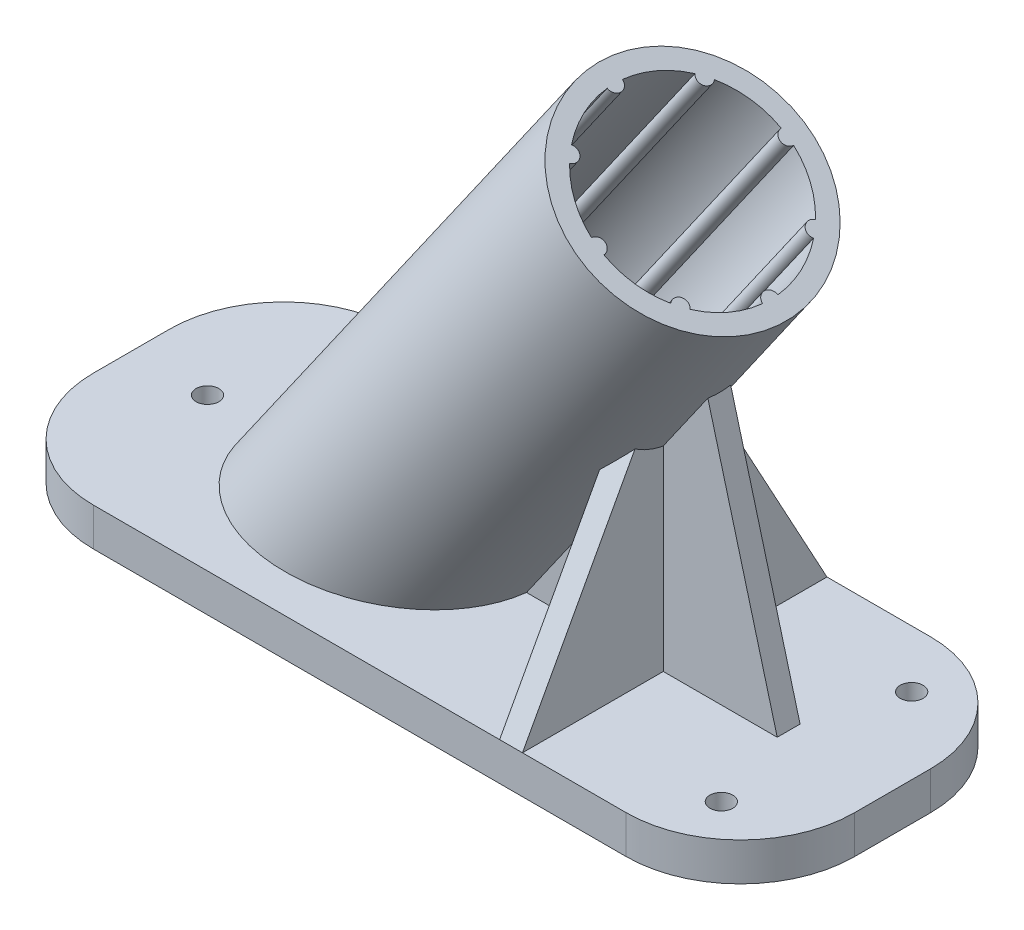
from build123d import *

# Parameters (mm, degrees)
BOSS_EXTRUDE1_DEPTH = 5
BOSS_EXTRUDE2_REACH = 104.182
SKETCH3_R           = 15
SKETCH3_R_2         = 12.5
BOSS_EXTRUDE3_REACH = 104.182
SKETCH4_R           = 1
CIRPATTERN1_START   = 1.089571064
CIRPATTERN1_DEPTH   = 61.685010975
CIRPATTERN1_START_2 = -13.151834357
CIRPATTERN1_2_DEPTH = 16.804980917
CIRPATTERN1_START_3 = -6.049458183
CIRPATTERN1_3_DEPTH = 9.702604743
RIB2_REACH          = 89.235
SKETCH5_WALL_W      = 196.470282612
SKETCH5_WALL_H      = 3
RIB3_REACH          = 101.962
SKETCH6_WALL_W      = 240.643320444
SKETCH6_WALL_H      = 3
SKETCH7_R           = 1.5
CUT_EXTRUDE1_DEPTH  = 5


with BuildPart() as part:
    # Sketch2 → Boss-Extrude1 (new body)
    with BuildSketch(Plane(origin=(0, 0, 0), x_dir=(1, 0, 0), z_dir=(0, 1, 0))):
        with BuildLine():
            Line((35, 20), (-35, 20))
            ThreePointArc((-35, 20), (-45.606601718, 15.606601718), (-50, 5))
            Line((-50, 5), (-50, -5))
            ThreePointArc((-50, -5), (-45.606601718, -15.606601718), (-35, -20))
            Line((-35, -20), (35, -20))
            ThreePointArc((35, -20), (45.606601718, -15.606601718), (50, -5))
            Line((50, -5), (50, 5))
            ThreePointArc((50, 5), (45.606601718, 15.606601718), (35, 20))
        make_face()
    extrude(amount=BOSS_EXTRUDE1_DEPTH)

    # Boss-Extrude2: up to this plane
    boss_extrude2_end = Plane(origin=(35, 5, 5), z_dir=(0, -1, 0))
    # Sketch3 → Boss-Extrude2 (add, up to the surface)
    with BuildSketch(Plane(origin=(36.006021059, 51.421927207, 0), x_dir=(0, 0, -1), z_dir=(0.5735764363510473, 0.819152044288991, 0)), mode=Mode.PRIVATE) as boss_extrude2_sk1:
        with Locations(Location((0, 15, 0), (0, 0, 90))):
            Circle(SKETCH3_R)
        with Locations(Location((0, 15, 0), (0, 0, 90))):
            Circle(SKETCH3_R_2, mode=Mode.SUBTRACT)
    boss_extrude2_tool1 = split(extrude(boss_extrude2_sk1.sketch, amount=-BOSS_EXTRUDE2_REACH, mode=Mode.PRIVATE), bisect_by=boss_extrude2_end, keep=Keep.BOTH, mode=Mode.PRIVATE)
    add(boss_extrude2_tool1.solids().sort_by_distance((35.658484, 51.665275, 0))[0])

    # Boss-Extrude3: up to this plane
    boss_extrude3_end = Plane(origin=(35, 5, 5), z_dir=(0, -1, 0))
    # Sketch4 → Boss-Extrude3 (add, up to the surface)
    with BuildSketch(Plane(origin=(36.006021059, 51.421927207, 0), x_dir=(0.819152044288991, -0.5735764363510474, 0), z_dir=(0.5735764363510474, 0.819152044288991, 0)), mode=Mode.PRIVATE) as boss_extrude3_sk1:
        with Locations((-15, 12.5)):
            Circle(SKETCH4_R)
    boss_extrude3_tool1 = split(extrude(boss_extrude3_sk1.sketch, amount=-BOSS_EXTRUDE3_REACH, mode=Mode.PRIVATE), bisect_by=boss_extrude3_end, keep=Keep.BOTH, mode=Mode.PRIVATE)
    add(boss_extrude3_tool1.solids().sort_by_distance((23.71874, 60.025574, -12.5))[0])

    # CirPattern1: read off the stored shape, not the designer's step
    # CirPattern1 outline → CirPattern1 (add)
    with BuildSketch(Plane(origin=(0, 0, 0), x_dir=(0.819152044288991, -0.5735764363510472, 0), z_dir=(0.5735764363510472, 0.8191520442889911, 0)).offset(CIRPATTERN1_START)):
        with BuildLine():
            ThreePointArc((-5.482908637, 8.104009624), (-6.161165235, 8.838834765), (-6.895990376, 9.517091363))
            ThreePointArc((-6.895990376, 9.517091363), (-6.868272016, 8.131727984), (-5.482908637, 8.104009624))
        make_face()
        with BuildLine():
            ThreePointArc((-23.104009624, 9.517091363), (-23.838834765, 8.838834765), (-24.517091363, 8.104009624))
            ThreePointArc((-24.517091363, 8.104009624), (-23.131727984, 8.131727984), (-23.104009624, 9.517091363))
        make_face()
        with BuildLine():
            ThreePointArc((-27.46, 0.99919968), (-27.5, 0), (-27.46, -0.99919968))
            ThreePointArc((-27.46, -0.99919968), (-26.5, 0), (-27.46, 0.99919968))
        make_face()
        with BuildLine():
            ThreePointArc((-24.517091363, -8.104009624), (-23.838834765, -8.838834765), (-23.104009624, -9.517091363))
            ThreePointArc((-23.104009624, -9.517091363), (-23.131727984, -8.131727984), (-24.517091363, -8.104009624))
        make_face()
        with BuildLine():
            ThreePointArc((-15.99919968, -12.46), (-15, -12.5), (-14.00080032, -12.46))
            ThreePointArc((-14.00080032, -12.46), (-15, -11.5), (-15.99919968, -12.46))
        make_face()
        with BuildLine():
            ThreePointArc((-6.895990376, -9.517091363), (-6.161165235, -8.838834765), (-5.482908637, -8.104009624))
            ThreePointArc((-5.482908637, -8.104009624), (-6.868272016, -8.131727984), (-6.895990376, -9.517091363))
        make_face()
        with BuildLine():
            ThreePointArc((-2.54, -0.99919968), (-2.5, 0), (-2.54, 0.99919968))
            ThreePointArc((-2.54, 0.99919968), (-3.5, 0), (-2.54, -0.99919968))
        make_face()
    extrude(amount=CIRPATTERN1_DEPTH)

    # CirPattern1 2 outline → CirPattern1 2 (add)
    with BuildSketch(Plane(origin=(0, 0, 0), x_dir=(0.819152044288991, -0.5735764363510472, 0), z_dir=(0.5735764363510472, 0.8191520442889911, 0)).offset(CIRPATTERN1_START_2)):
        with BuildLine():
            ThreePointArc((-23.104009624, 9.517091363), (-23.838834765, 8.838834765), (-24.517091363, 8.104009624))
            ThreePointArc((-24.517091363, 8.104009624), (-23.131727984, 8.131727984), (-23.104009624, 9.517091363))
        make_face()
        with BuildLine():
            ThreePointArc((-27.46, 0.99919968), (-27.5, 0), (-27.46, -0.99919968))
            ThreePointArc((-27.46, -0.99919968), (-26.5, 0), (-27.46, 0.99919968))
        make_face()
        with BuildLine():
            ThreePointArc((-24.517091363, -8.104009624), (-23.838834765, -8.838834765), (-23.104009624, -9.517091363))
            ThreePointArc((-23.104009624, -9.517091363), (-23.131727984, -8.131727984), (-24.517091363, -8.104009624))
        make_face()
    extrude(amount=CIRPATTERN1_2_DEPTH)

    # CirPattern1 3 outline → CirPattern1 3 (add)
    with BuildSketch(Plane(origin=(0, 0, 0), x_dir=(0.819152044288991, -0.5735764363510472, 0), z_dir=(0.5735764363510472, 0.8191520442889911, 0)).offset(CIRPATTERN1_START_3)):
        with BuildLine():
            ThreePointArc((-15.99919968, -12.46), (-15, -12.5), (-14.00080032, -12.46))
            ThreePointArc((-14.00080032, -12.46), (-15, -11.5), (-15.99919968, -12.46))
        make_face()
    extrude(amount=CIRPATTERN1_3_DEPTH)

    # Sketch5 wall → Rib2 (add, up to next)
    with BuildSketch(Plane(origin=(32.411809549, 19.659258263, 0), x_dir=(0.258819045097, -0.96592582629, 0), z_dir=(0.96592582629, 0.258819045097, 0)), mode=Mode.PRIVATE) as rib2_sk1:
        Rectangle(SKETCH5_WALL_W, SKETCH5_WALL_H)
    rib2_tool1 = extrude(rib2_sk1.sketch, amount=-RIB2_REACH, mode=Mode.PRIVATE) - part.part
    add(rib2_tool1.solids().sort_by_distance((32.411809549, 19.659258263, 0))[0])

    # Sketch6 wall → Rib3 (add, up to next)
    with BuildSketch(Plane(origin=(19.874497756, 22.00680033, 10.75), x_dir=(0, -0.878468996126, 0.47779935417), z_dir=(0, -0.47779935417, -0.878468996126)), mode=Mode.PRIVATE) as rib3_sk1:
        Rectangle(SKETCH6_WALL_W, SKETCH6_WALL_H)
    rib3_tool1 = extrude(rib3_sk1.sketch, amount=RIB3_REACH, mode=Mode.PRIVATE) - part.part
    rib3 = rib3_tool1.solids().sort_by_distance((19.874497756, 22.00680033, 10.75))[0]
    add(rib3)

    # Mirror1: Rib3 across plane
    add(rib3.mirror(Plane.XY))

    # Sketch7 → Cut-Extrude1 (cut)
    with BuildSketch(Plane.XZ):
        with Locations(Location((-40, 0, 0), (0, 0, 270))):
            Circle(SKETCH7_R)
        with Locations(Location((40, -12.5, 0), (0, 0, 270))):
            Circle(SKETCH7_R)
        with Locations(Location((40, 12.5, 0), (0, 0, 270))):
            Circle(SKETCH7_R)
    extrude(amount=-CUT_EXTRUDE1_DEPTH, mode=Mode.SUBTRACT)


solid = part.part
